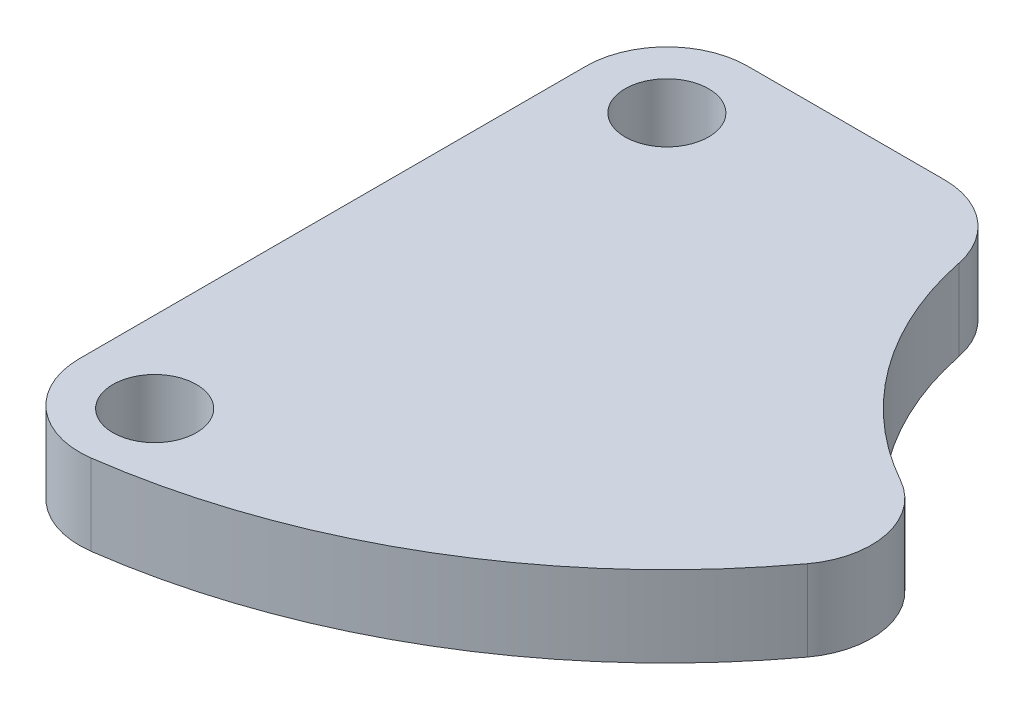
from build123d import *

# Parameters (mm, degrees)
SKETCH1_W              = 25
SKETCH1_H              = 25
SKETCH1_R              = 1.55
BOSS_EXTRUDE1_DEPTH    = 3
FILLET1_R              = 25
CUT_EXTRUDE1_OUTLINE_W = 12
CUT_EXTRUDE1_OUTLINE_H = 3
FILLET3_R              = 3
FILLET4_R              = 3


# Read off the part's stored shape, not the designer's step: Cut-Extrude1
with BuildPart() as part:
    # Sketch1 → Boss-Extrude1 (new body)
    with BuildSketch(Plane(origin=(0, 0, 0), x_dir=(1, 0, 0), z_dir=(0, 1, 0))):
        Rectangle(SKETCH1_W, SKETCH1_H)
        with Locations(Location((-9.5, 9.5, 0), (0, 0, 270))):
            Circle(SKETCH1_R, mode=Mode.SUBTRACT)
        with Locations(Location((-9.5, -9.5, 0), (0, 0, 270))):
            Circle(SKETCH1_R, mode=Mode.SUBTRACT)
    extrude(amount=-BOSS_EXTRUDE1_DEPTH)

    # Fillet1
    fillet1_edges = [part.edges().sort_by_distance(p)[0] for p in [
        (12.5, -1.5, 12.5),
    ]]
    fillet(fillet1_edges, radius=FILLET1_R - 0.0001)  # a hair under: the kernel refuses the full size

    # Cut-Extrude1 outline → Cut-Extrude1 (revolve, cut)
    with BuildSketch(Plane(origin=(12.5, 0, -12.5), x_dir=(1, 0, 0), z_dir=(0, 0, 1))):
        with Locations((6, -1.5)):
            Rectangle(CUT_EXTRUDE1_OUTLINE_W, CUT_EXTRUDE1_OUTLINE_H)
    revolve(axis=Axis((12.5, 0, -12.5), (0, 1, 0)), mode=Mode.SUBTRACT)

    # Fillet3
    fillet3_edges = [part.edges().sort_by_distance(p)[0] for p in [
        (9.620035077, -1.5, -0.850716673),
        (0.5, -1.5, -12.5),
    ]]
    fillet(fillet3_edges, radius=FILLET3_R)

    # Fillet4
    fillet4_edges = [part.edges().sort_by_distance(p)[0] for p in [
        (-12.5, -1.5, 12.5),
        (-12.5, -1.5, -12.5),
    ]]
    fillet(fillet4_edges, radius=FILLET4_R)


solid = part.part
